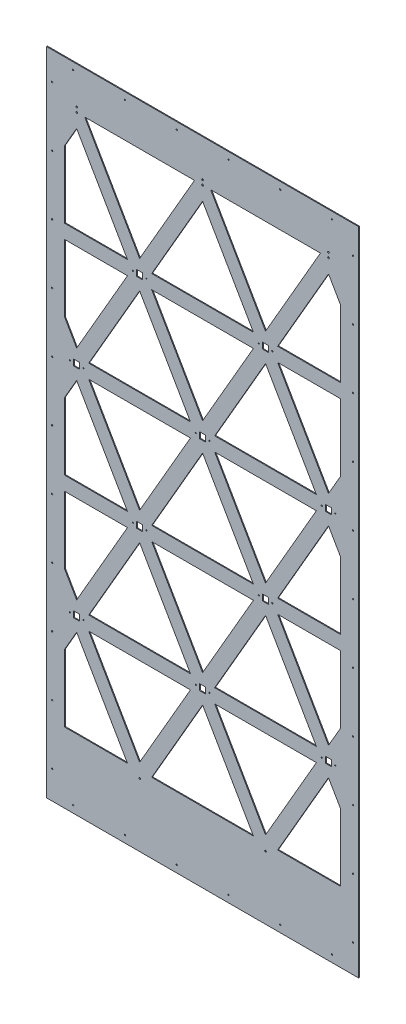
from build123d import *

# Parameters (mm, degrees)
STOCK_FRA_P25_1_OUTLINE_R   = 2.9972
STOCK_FRA_P25_1_OUTLINE_R_2 = 2.0828
STOCK_FRA_P25_1_OUTLINE_W   = 21.9964
STOCK_FRA_P25_1_OUTLINE_H   = 21.9964
STOCK_FRA_P25_1_DEPTH       = 3.175
BOSS_EXTRUDE1_DEPTH         = 3.175
SKETCH2_R                   = 2.38125
CUT_EXTRUDE1_DEPTH          = 1313.105003658
LPATTERN1_COUNT             = 6
LPATTERN1_PITCH             = 187.96
SKETCH3_R                   = 2.38125
CUT_EXTRUDE2_DEPTH          = 1313.105003658
LPATTERN2_COUNT             = 11
LPATTERN2_PITCH             = 215.9
SKETCH4_W                   = 3.175
SKETCH4_H                   = 2362.2
CUT_EXTRUDE3_DEPTH          = 5.08
SKETCH5_W                   = 3.175
SKETCH5_H                   = 2362.2
CUT_EXTRUDE4_DEPTH          = 5.08
SKETCH7_R                   = 2.9972
CUT_EXTRUDE6_DEPTH          = 1310.900342402
LPATTERN3_COUNT             = 7
LPATTERN3_PITCH             = 457.2
LPATTERN3_COUNT_DIR2        = 2
LPATTERN3_PITCH_DIR2        = 457.2


# Read off the part's stored shape, not the designer's step: Stock-FRA - P25-1
with BuildPart() as part:
    # Stock-FRA - P25-1 outline → Stock-FRA - P25-1 (new body)
    with BuildSketch(Plane.XY):
        Polygon((-571.5, -529.687258441), (-571.5, -580.487258441), (-501.194090512, -580.487258441), (-571.5, -702.260665746), (-571.5, -803.860665746), (-457.2, -605.887258441), (-272.594090512, -925.634073051), (-571.5, -925.634073051), (-571.5, -1181.1), (571.5, -1181.1), (571.5, -925.634073051), (272.594090512, -925.634073051), (457.2, -605.887258441), (571.5, -803.860665746), (571.5, -702.260665746), (501.194090512, -580.487258441), (571.5, -580.487258441), (571.5, -529.687258441), (501.194090512, -529.687258441), (571.5, -407.913851136), (571.5, -306.313851136), (457.2, -504.287258441), (272.594090512, -184.540443831), (571.5, -184.540443831), (571.5, -133.740443831), (272.594090512, -133.740443831), (457.2, 186.00637078), (571.5, -11.967036526), (571.5, 89.632963474), (501.194090512, 211.40637078), (571.5, 211.40637078), (571.5, 262.20637078), (501.194090512, 262.20637078), (571.5, 383.979778085), (571.5, 485.579778085), (457.2, 287.60637078), (272.594090512, 607.35318539), (571.5, 607.35318539), (571.5, 658.15318539), (272.594090512, 658.15318539), (457.2, 977.9), (571.5, 779.926592695), (571.5, 881.526592695), (486.529393675, 1028.7), (571.5, 1028.7), (571.5, 1181.1), (-571.5, 1181.1), (-571.5, 1028.7), (-486.529393675, 1028.7), (-571.5, 881.526592695), (-571.5, 779.926592695), (-457.2, 977.9), (-272.594090512, 658.15318539), (-571.5, 658.15318539), (-571.5, 607.35318539), (-272.594090512, 607.35318539), (-457.2, 287.60637078), (-571.5, 485.579778085), (-571.5, 383.979778085), (-501.194090512, 262.20637078), (-571.5, 262.20637078), (-571.5, 211.40637078), (-501.194090512, 211.40637078), (-571.5, 89.632963474), (-571.5, -11.967036526), (-457.2, 186.00637078), (-272.594090512, -133.740443831), (-571.5, -133.740443831), (-571.5, -184.540443831), (-272.594090512, -184.540443831), (-457.2, -504.287258441), (-571.5, -306.313851136), (-571.5, -407.913851136), (-501.194090512, -529.687258441), align=None)
        with Locations((-228.6, -951.034073051)):
            Circle(STOCK_FRA_P25_1_OUTLINE_R, mode=Mode.SUBTRACT)
        Polygon((-413.205909488, -580.487258441), (-43.994090512, -580.487258441), (-228.6, -900.234073051), align=None, mode=Mode.SUBTRACT)
        with Locations((-481.6856, -555.087258441)):
            Circle(STOCK_FRA_P25_1_OUTLINE_R_2, mode=Mode.SUBTRACT)
        with Locations((-457.2, -555.087258441)):
            Rectangle(STOCK_FRA_P25_1_OUTLINE_W, STOCK_FRA_P25_1_OUTLINE_H, mode=Mode.SUBTRACT)
        with Locations((-432.689, -555.087258441)):
            Circle(STOCK_FRA_P25_1_OUTLINE_R_2, mode=Mode.SUBTRACT)
        Polygon((-43.994090512, -529.687258441), (-413.205909488, -529.687258441), (-228.6, -209.940443831), align=None, mode=Mode.SUBTRACT)
        with Locations((-24.4856, -555.087258441)):
            Circle(STOCK_FRA_P25_1_OUTLINE_R_2, mode=Mode.SUBTRACT)
        with Locations((-253.111, -159.140443831)):
            Circle(STOCK_FRA_P25_1_OUTLINE_R_2, mode=Mode.SUBTRACT)
        with Locations((-228.6, -159.140443831)):
            Rectangle(STOCK_FRA_P25_1_OUTLINE_W, STOCK_FRA_P25_1_OUTLINE_H, mode=Mode.SUBTRACT)
        with Locations((-204.1144, -159.140443831)):
            Circle(STOCK_FRA_P25_1_OUTLINE_R_2, mode=Mode.SUBTRACT)
        with Locations((228.6, -951.034073051)):
            Circle(STOCK_FRA_P25_1_OUTLINE_R, mode=Mode.SUBTRACT)
        Polygon((0, -605.887258441), (184.605909488, -925.634073051), (-184.605909488, -925.634073051), align=None, mode=Mode.SUBTRACT)
        Polygon((413.205909488, -580.487258441), (228.6, -900.234073051), (43.994090512, -580.487258441), align=None, mode=Mode.SUBTRACT)
        with Locations((0, -555.087258441)):
            Rectangle(STOCK_FRA_P25_1_OUTLINE_W, STOCK_FRA_P25_1_OUTLINE_H, mode=Mode.SUBTRACT)
        with Locations((24.511, -555.087258441)):
            Circle(STOCK_FRA_P25_1_OUTLINE_R_2, mode=Mode.SUBTRACT)
        Polygon((-184.605909488, -184.540443831), (184.605909488, -184.540443831), (0, -504.287258441), align=None, mode=Mode.SUBTRACT)
        Polygon((413.205909488, -529.687258441), (43.994090512, -529.687258441), (228.6, -209.940443831), align=None, mode=Mode.SUBTRACT)
        with Locations((204.1144, -159.140443831)):
            Circle(STOCK_FRA_P25_1_OUTLINE_R_2, mode=Mode.SUBTRACT)
        with Locations((228.6, -159.140443831)):
            Rectangle(STOCK_FRA_P25_1_OUTLINE_W, STOCK_FRA_P25_1_OUTLINE_H, mode=Mode.SUBTRACT)
        with Locations((253.111, -159.140443831)):
            Circle(STOCK_FRA_P25_1_OUTLINE_R_2, mode=Mode.SUBTRACT)
        with Locations((432.7144, -555.087258441)):
            Circle(STOCK_FRA_P25_1_OUTLINE_R_2, mode=Mode.SUBTRACT)
        with Locations((457.2, -555.087258441)):
            Rectangle(STOCK_FRA_P25_1_OUTLINE_W, STOCK_FRA_P25_1_OUTLINE_H, mode=Mode.SUBTRACT)
        with Locations((481.711, -555.087258441)):
            Circle(STOCK_FRA_P25_1_OUTLINE_R_2, mode=Mode.SUBTRACT)
        with Locations((-481.711, 236.80637078)):
            Circle(STOCK_FRA_P25_1_OUTLINE_R_2, mode=Mode.SUBTRACT)
        with Locations((-457.2, 236.80637078)):
            Rectangle(STOCK_FRA_P25_1_OUTLINE_W, STOCK_FRA_P25_1_OUTLINE_H, mode=Mode.SUBTRACT)
        with Locations((-432.7144, 236.80637078)):
            Circle(STOCK_FRA_P25_1_OUTLINE_R_2, mode=Mode.SUBTRACT)
        Polygon((-43.994090512, 211.40637078), (-228.6, -108.340443831), (-413.205909488, 211.40637078), align=None, mode=Mode.SUBTRACT)
        with Locations((-24.511, 236.80637078)):
            Circle(STOCK_FRA_P25_1_OUTLINE_R_2, mode=Mode.SUBTRACT)
        Polygon((-228.6, 581.95318539), (-43.994090512, 262.20637078), (-413.205909488, 262.20637078), align=None, mode=Mode.SUBTRACT)
        with Locations((-457.2, 1028.7)):
            Circle(STOCK_FRA_P25_1_OUTLINE_R, mode=Mode.SUBTRACT)
        with Locations((-253.0856, 632.75318539)):
            Circle(STOCK_FRA_P25_1_OUTLINE_R_2, mode=Mode.SUBTRACT)
        with Locations((-228.6, 632.75318539)):
            Rectangle(STOCK_FRA_P25_1_OUTLINE_W, STOCK_FRA_P25_1_OUTLINE_H, mode=Mode.SUBTRACT)
        with Locations((-204.089, 632.75318539)):
            Circle(STOCK_FRA_P25_1_OUTLINE_R_2, mode=Mode.SUBTRACT)
        Polygon((-427.870606325, 1028.7), (-29.329393675, 1028.7), (-228.6, 683.55318539), align=None, mode=Mode.SUBTRACT)
        Polygon((0, 186.00637078), (184.605909488, -133.740443831), (-184.605909488, -133.740443831), align=None, mode=Mode.SUBTRACT)
        with Locations((0, 236.80637078)):
            Rectangle(STOCK_FRA_P25_1_OUTLINE_W, STOCK_FRA_P25_1_OUTLINE_H, mode=Mode.SUBTRACT)
        with Locations((24.4856, 236.80637078)):
            Circle(STOCK_FRA_P25_1_OUTLINE_R_2, mode=Mode.SUBTRACT)
        Polygon((228.6, -108.340443831), (43.994090512, 211.40637078), (413.205909488, 211.40637078), align=None, mode=Mode.SUBTRACT)
        Polygon((-184.605909488, 607.35318539), (184.605909488, 607.35318539), (0, 287.60637078), align=None, mode=Mode.SUBTRACT)
        Polygon((413.205909488, 262.20637078), (43.994090512, 262.20637078), (228.6, 581.95318539), align=None, mode=Mode.SUBTRACT)
        with Locations((432.689, 236.80637078)):
            Circle(STOCK_FRA_P25_1_OUTLINE_R_2, mode=Mode.SUBTRACT)
        with Locations((457.2, 236.80637078)):
            Rectangle(STOCK_FRA_P25_1_OUTLINE_W, STOCK_FRA_P25_1_OUTLINE_H, mode=Mode.SUBTRACT)
        with Locations((481.6856, 236.80637078)):
            Circle(STOCK_FRA_P25_1_OUTLINE_R_2, mode=Mode.SUBTRACT)
        Polygon((-184.605909488, 658.15318539), (0, 977.9), (184.605909488, 658.15318539), align=None, mode=Mode.SUBTRACT)
        with Locations((204.089, 632.75318539)):
            Circle(STOCK_FRA_P25_1_OUTLINE_R_2, mode=Mode.SUBTRACT)
        with Locations((228.6, 632.75318539)):
            Rectangle(STOCK_FRA_P25_1_OUTLINE_W, STOCK_FRA_P25_1_OUTLINE_H, mode=Mode.SUBTRACT)
        with Locations((253.111, 632.75318539)):
            Circle(STOCK_FRA_P25_1_OUTLINE_R_2, mode=Mode.SUBTRACT)
        Polygon((228.6, 683.55318539), (29.329393675, 1028.7), (427.870606325, 1028.7), align=None, mode=Mode.SUBTRACT)
        with Locations((0, 1028.7)):
            Circle(STOCK_FRA_P25_1_OUTLINE_R, mode=Mode.SUBTRACT)
        with Locations((457.2, 1028.7)):
            Circle(STOCK_FRA_P25_1_OUTLINE_R, mode=Mode.SUBTRACT)
    extrude(amount=STOCK_FRA_P25_1_DEPTH)

    # Sketch1 → Boss-Extrude1 (add)
    with BuildSketch(Plane.XY.offset(3.175)):
        Polygon((571.5, 1028.7), (500.38, 1028.7), (486.529393675, 1028.7), (486.529393675, 1004.710046129), (500.38, 1004.710046129), (500.38, -925.634073051), (571.5, -925.634073051), align=None)
        Polygon((-571.5, 1028.7), (-500.38, 1028.7), (-486.529393675, 1028.7), (-486.529393675, 1004.710046129), (-500.38, 1004.710046129), (-500.38, -925.634073051), (-571.5, -925.634073051), align=None)
    extrude(amount=-BOSS_EXTRUDE1_DEPTH)

    # Sketch2 → Cut-Extrude1 (cut, through all)
    with BuildSketch(Plane.XY.offset(3.175)):
        with Locations((-469.9, 1155.7)):
            Circle(SKETCH2_R)
        with Locations((-469.9, -1155.7)):
            Circle(SKETCH2_R)
    cut_extrude1 = extrude(amount=-CUT_EXTRUDE1_DEPTH, mode=Mode.SUBTRACT)

    # LPattern1: Cut-Extrude1 ×6
    with Locations(*[(i * LPATTERN1_PITCH, 0, 0) for i in range(1, LPATTERN1_COUNT)]):
        add(cut_extrude1, mode=Mode.SUBTRACT)

    # Sketch3 → Cut-Extrude2 (cut, through all)
    with BuildSketch(Plane.XY.offset(3.175)):
        with Locations((-546.1, 1079.5)):
            Circle(SKETCH3_R)
        with Locations((546.1, 1079.5)):
            Circle(SKETCH3_R)
    cut_extrude2 = extrude(amount=-CUT_EXTRUDE2_DEPTH, mode=Mode.SUBTRACT)

    # LPattern2: Cut-Extrude2 ×11
    with Locations(*[(0, -i * LPATTERN2_PITCH, 0) for i in range(1, LPATTERN2_COUNT)]):
        add(cut_extrude2, mode=Mode.SUBTRACT)

    # Sketch4 → Cut-Extrude3 (cut)
    with BuildSketch(Plane(origin=(571.5, 0, 0), x_dir=(0, 0, -1), z_dir=(1, 0, 0))):
        with Locations((-1.5875, 0)):
            Rectangle(SKETCH4_W, SKETCH4_H)
    extrude(amount=-CUT_EXTRUDE3_DEPTH, mode=Mode.SUBTRACT)

    # Sketch5 → Cut-Extrude4 (cut)
    with BuildSketch(Plane.ZY.offset(571.5)):
        with Locations((1.5875, 0)):
            Rectangle(SKETCH5_W, SKETCH5_H)
    extrude(amount=-CUT_EXTRUDE4_DEPTH, mode=Mode.SUBTRACT)

    # Sketch7 → Cut-Extrude6 (cut, through all)
    with BuildSketch(Plane.XY.offset(3.175)):
        with Locations((0, 1045.633333333)):
            Circle(SKETCH7_R)
    cut_extrude6 = extrude(amount=-CUT_EXTRUDE6_DEPTH, mode=Mode.SUBTRACT)

    # LPattern3: Cut-Extrude6 7 × 2
    with Locations(*[Vector(1, 0, 0) * (i * LPATTERN3_PITCH) + Vector(-1, 0, 0) * (j * LPATTERN3_PITCH_DIR2) for i in range(LPATTERN3_COUNT) for j in range(LPATTERN3_COUNT_DIR2) if (i, j) != (0, 0)]):
        add(cut_extrude6, mode=Mode.SUBTRACT)


solid = part.part
